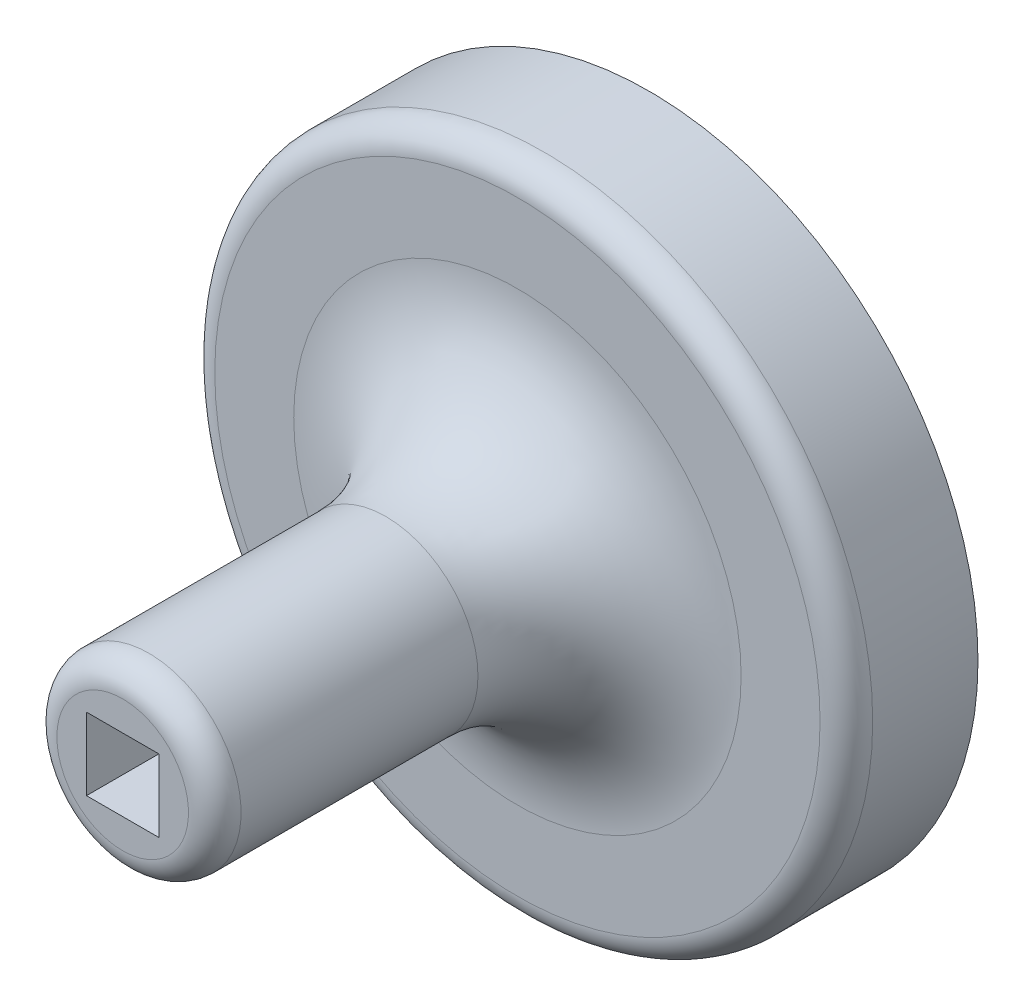
from build123d import *

# Parameters (mm, degrees)
ESQUISSE1_R             = 25
BOSS_EXTRU_1_DEPTH      = 10
ESQUISSE2_R             = 7
BOSS_EXTRU_2_DEPTH      = 40
ESQUISSE3_W             = 5.5
ESQUISSE3_H             = 5.5
ENL_V_MAT_EXTRU_1_DEPTH = 40
CONG_1_R                = 10
CONG_2_R                = 2


with BuildPart() as part:
    # Esquisse1 → Boss.-Extru.1 (new body)
    with BuildSketch(Plane.XY):
        Circle(ESQUISSE1_R)
    extrude(amount=BOSS_EXTRU_1_DEPTH)

    # Esquisse2 → Boss.-Extru.2 (add)
    with BuildSketch(Plane(origin=(0, 0, 0), x_dir=(-1, 0, 0), z_dir=(0, 0, -1))):
        Circle(ESQUISSE2_R)
    extrude(amount=-BOSS_EXTRU_2_DEPTH)

    # Esquisse3 → Enlèv. mat.-Extru.1 (cut)
    with BuildSketch(Plane(origin=(0, 0, 0), x_dir=(-1, 0, 0), z_dir=(0, 0, -1))):
        Rectangle(ESQUISSE3_W, ESQUISSE3_H)
    extrude(amount=-ENL_V_MAT_EXTRU_1_DEPTH, mode=Mode.SUBTRACT)

    # Congé1
    cong_1_edges = [part.edges().sort_by_distance(p)[0] for p in [
        (7, 0, 10),
    ]]
    fillet(cong_1_edges, radius=CONG_1_R)

    # Congé2
    cong_2_edges = [part.edges().sort_by_distance(p)[0] for p in [
        (-25, 0, 10),
        (7, 0, 40),
    ]]
    fillet(cong_2_edges, radius=CONG_2_R)


solid = part.part
